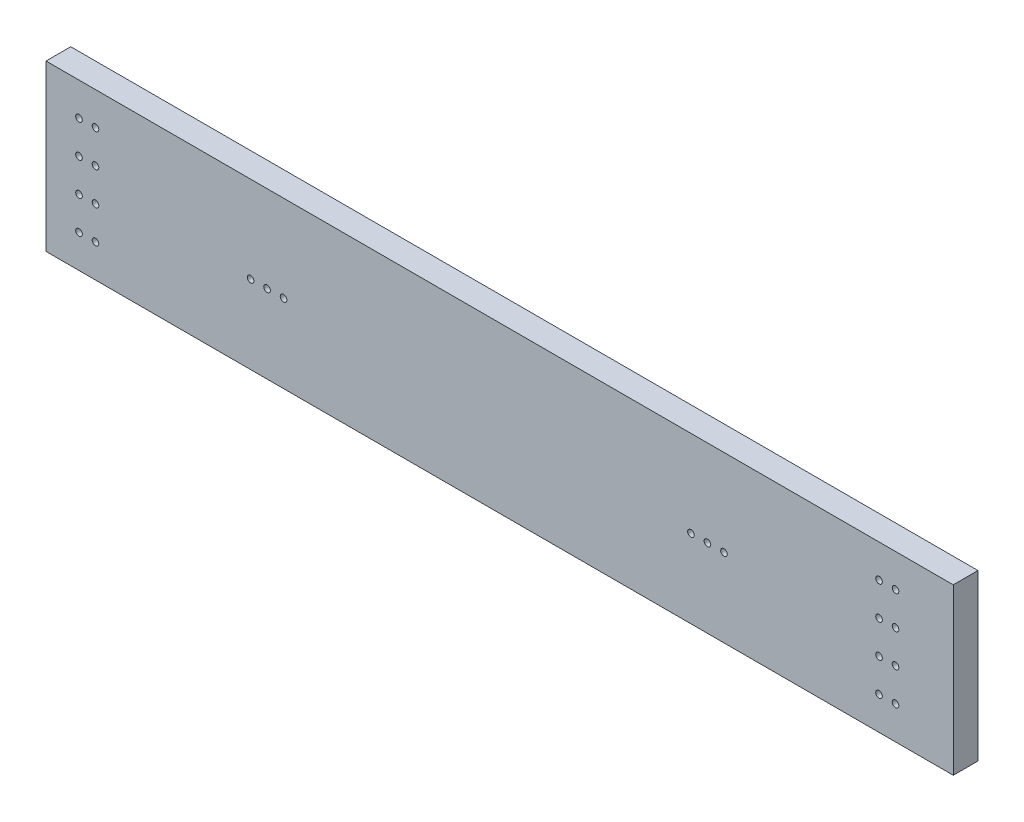
from build123d import *

# Parameters (mm, degrees)
SKETCH1_W           = 698.5
SKETCH1_H           = 127
BOSS_EXTRUDE1_DEPTH = 19.05
SKETCH2_R           = 2.54
CUT_EXTRUDE1_DEPTH  = 356.486589058


with BuildPart() as part:
    # Sketch1 → Boss-Extrude1 (new body)
    with BuildSketch(Plane.XY):
        Rectangle(SKETCH1_W, SKETCH1_H)
    extrude(amount=BOSS_EXTRUDE1_DEPTH)

    # Sketch2 → Cut-Extrude1 (cut, through all)
    with BuildSketch(Plane.XY.offset(19.05)):
        with Locations((304.8, 38.1)):
            Circle(SKETCH2_R)
        with Locations((304.8, 12.7)):
            Circle(SKETCH2_R)
        with Locations((304.8, -12.7)):
            Circle(SKETCH2_R)
        with Locations((304.8, -38.1)):
            Circle(SKETCH2_R)
        with Locations((292.1, -38.1)):
            Circle(SKETCH2_R)
        with Locations((292.1, -12.7)):
            Circle(SKETCH2_R)
        with Locations((292.1, 12.7)):
            Circle(SKETCH2_R)
        with Locations((292.1, 38.1)):
            Circle(SKETCH2_R)
        with Locations((-323.85, 38.1)):
            Circle(SKETCH2_R)
        with Locations((-311.15, 38.1)):
            Circle(SKETCH2_R)
        with Locations((-323.85, 12.7)):
            Circle(SKETCH2_R)
        with Locations((-311.15, 12.7)):
            Circle(SKETCH2_R)
        with Locations((-323.85, -12.7)):
            Circle(SKETCH2_R)
        with Locations((-311.15, -12.7)):
            Circle(SKETCH2_R)
        with Locations((-323.85, -38.1)):
            Circle(SKETCH2_R)
        with Locations((-311.15, -38.1)):
            Circle(SKETCH2_R)
        with Locations((147.32, -3.175)):
            Circle(SKETCH2_R)
        with Locations((160.02, -3.175)):
            Circle(SKETCH2_R)
        with Locations((172.72, -3.175)):
            Circle(SKETCH2_R)
        with Locations((-191.77, -3.175)):
            Circle(SKETCH2_R)
        with Locations((-179.07, -3.175)):
            Circle(SKETCH2_R)
        with Locations((-166.37, -3.175)):
            Circle(SKETCH2_R)
    extrude(amount=-CUT_EXTRUDE1_DEPTH, mode=Mode.SUBTRACT)


solid = part.part
